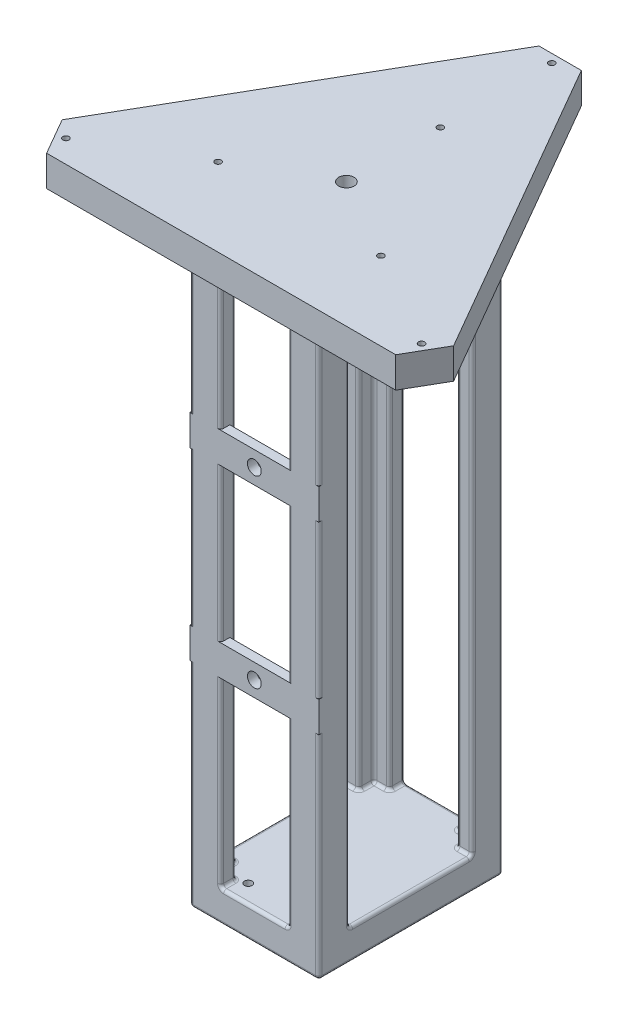
from build123d import *

# Parameters (mm, degrees)
ESQUISSE1_R                  = 2.5
BOSS_EXTRU_1_DEPTH           = 5
BOSS_EXTRU_2_DEPTH           = 180
ESQUISSE7_W                  = 42
ESQUISSE7_H                  = 60
BOSS_EXTRU_3_DEPTH           = 10
CONG_3_R                     = 1
ENL_V_MAT_EXTRU_4_REACH      = 223.178
ESQUISSE8_R                  = 1.25
ESQUISSE12_W                 = 42
ESQUISSE12_H                 = 10
ESQUISSE12_R                 = 2.25
BOSS_EXTRU_5_DEPTH           = 3
ESQUISSE14_R                 = 1
ENL_V_MAT_EXTRU_5_DEPTH      = 222.178295018
R_P_TITION_CIRCULAIRE1_COUNT = 3


with BuildPart() as part:
    # Esquisse1 → Boss.-Extru.1 (new, symmetric)
    with BuildSketch(Plane(origin=(0, 0, 0), x_dir=(1, 0, 0), z_dir=(0, 1, 0))):
        Polygon((-6.9, 69.659098472), (6.9, 69.659098472), (63.776548882, -28.85397395), (56.876548882, -40.805124522), (-56.876548882, -40.805124522), (-63.776548882, -28.85397395), align=None)
        Circle(ESQUISSE1_R, mode=Mode.SUBTRACT)
    extrude(amount=BOSS_EXTRU_1_DEPTH, both=True)

    # Esquisse3 → Boss.-Extru.2 (add)
    with BuildSketch(Plane.XZ.offset(5)):
        Polygon((21, 30), (11, 30), (11, 25), (16, 25), (16, 20), (21, 20), align=None)
        Polygon((21, -20), (16, -20), (16, -25), (11, -25), (11, -30), (21, -30), align=None)
        Polygon((-21, -30), (-21, -20), (-16, -20), (-16, -25), (-11, -25), (-11, -30), align=None)
        Polygon((-21, 30), (-21, 20), (-16, 20), (-16, 25), (-11, 25), (-11, 30), align=None)
    extrude(amount=BOSS_EXTRU_2_DEPTH)

    # Esquisse7 → Boss.-Extru.3 (add)
    with BuildSketch(Plane.XZ.offset(185)):
        Rectangle(ESQUISSE7_W, ESQUISSE7_H)
    extrude(amount=BOSS_EXTRU_3_DEPTH)

    # Congé3
    cong_3_edges = [part.edges().sort_by_distance(p)[0] for p in [
        (-18.5, -185, 20),
        (-18.5, -5, 20),
        (-16, -95, 20),
        (-16, -185, 22.5),
        (-16, -5, 22.5),
        (-16, -95, 25),
        (-13.5, -185, 25),
        (-13.5, -5, 25),
        (-11, -95, 25),
        (-11, -185, 27.5),
        (-11, -5, 27.5),
        (18.5, -185, -20),
        (18.5, -5, -20),
        (16, -95, -20),
        (16, -185, -22.5),
        (16, -5, -22.5),
        (16, -95, -25),
        (13.5, -185, -25),
        (13.5, -5, -25),
        (11, -95, -25),
        (11, -185, -27.5),
        (11, -5, -27.5),
        (11, -185, 27.5),
        (11, -5, 27.5),
        (11, -95, 25),
        (13.5, -185, 25),
        (13.5, -5, 25),
        (16, -95, 25),
        (16, -185, 22.5),
        (16, -5, 22.5),
        (16, -95, 20),
        (18.5, -185, 20),
        (18.5, -5, 20),
        (-11, -185, -27.5),
        (-11, -5, -27.5),
        (-11, -95, -25),
        (-13.5, -185, -25),
        (-13.5, -5, -25),
        (-16, -95, -25),
        (-16, -185, -22.5),
        (-16, -5, -22.5),
        (-16, -95, -20),
        (-18.5, -185, -20),
        (-18.5, -5, -20),
        (21, -5, 25),
        (21, -95, 20),
        (21, -95, -20),
        (21, -5, -25),
        (11, -95, -30),
        (-11, -95, -30),
        (-16, -5, -30),
        (21, -100, -30),
        (16, -5, -30),
        (-21, -100, -30),
        (-21, -5, -25),
        (-21, -95, -20),
        (-21, -95, 20),
        (-21, -5, 25),
        (-11, -95, 30),
        (11, -95, 30),
        (16, -5, 30),
        (21, -100, 30),
        (-21, -100, 30),
        (-16, -5, 30),
        (21, -195, 0),
        (21, -185, 0),
        (0, -185, -30),
        (0, -195, -30),
        (-21, -195, 0),
        (-21, -185, 0),
        (0, -185, 30),
        (0, -195, 30),
    ]]
    fillet(cong_3_edges, radius=CONG_3_R)

    # Esquisse8 → Enlèv. mat.-Extru.4 (cut, up to next)
    with BuildSketch(Plane.XZ.offset(195), mode=Mode.PRIVATE) as enl_v_mat_extru_4_sk1:
        with Locations((8, 24)):
            Circle(ESQUISSE8_R)
    enl_v_mat_extru_4_tool1 = extrude(enl_v_mat_extru_4_sk1.sketch, amount=-ENL_V_MAT_EXTRU_4_REACH, mode=Mode.PRIVATE) & part.part
    # Esquisse8 → Enlèv. mat.-Extru.4 (cut, up to next)
    with BuildSketch(Plane.XZ.offset(195), mode=Mode.PRIVATE) as enl_v_mat_extru_4_sk2:
        with Locations((-8, 24)):
            Circle(ESQUISSE8_R)
    enl_v_mat_extru_4_tool2 = extrude(enl_v_mat_extru_4_sk2.sketch, amount=-ENL_V_MAT_EXTRU_4_REACH, mode=Mode.PRIVATE) & part.part
    add(enl_v_mat_extru_4_tool1.solids().sort_by_distance((8, -195, 24))[0], mode=Mode.SUBTRACT)
    add(enl_v_mat_extru_4_tool2.solids().sort_by_distance((-8, -195, 24))[0], mode=Mode.SUBTRACT)

    # Esquisse12 → Boss.-Extru.5 (add)
    # profile 1 of 2: a face of its own
    with BuildSketch(Plane.XY.offset(30)):
        with Locations((0, -60.62)):
            Rectangle(ESQUISSE12_W, ESQUISSE12_H)
        with Locations((0, -60.62)):
            Circle(ESQUISSE12_R, mode=Mode.SUBTRACT)
    # profile 2 of 2: a face of its own
    with BuildSketch(Plane.XY.offset(30)):
        with Locations((0, -120.62)):
            Rectangle(ESQUISSE12_W, ESQUISSE12_H)
        with Locations((0, -120.62)):
            Circle(ESQUISSE12_R, mode=Mode.SUBTRACT)
    extrude(amount=-BOSS_EXTRU_5_DEPTH)

    # Esquisse14 → Enlèv. mat.-Extru.5 (cut, through all)
    with BuildSketch(Plane(origin=(0, 5, 0), x_dir=(1, 0, 0), z_dir=(0, 1, 0))):
        with Locations((-57.944979021, -33.454549236)):
            Circle(ESQUISSE14_R)
        with Locations((-26.508256864, -15.304549236)):
            Circle(ESQUISSE14_R)
    enl_v_mat_extru_5 = extrude(amount=-ENL_V_MAT_EXTRU_5_DEPTH, mode=Mode.SUBTRACT)

    # Répétition circulaire1: Enlèv. mat.-Extru.5 ×3 about axis
    r_p_tition_circulaire1_axis = Axis((0, 5, 0), (0, -1, 0))
    for i in range(1, R_P_TITION_CIRCULAIRE1_COUNT):
        add(enl_v_mat_extru_5.rotate(r_p_tition_circulaire1_axis, i * 360 / R_P_TITION_CIRCULAIRE1_COUNT), mode=Mode.SUBTRACT)


solid = part.part
